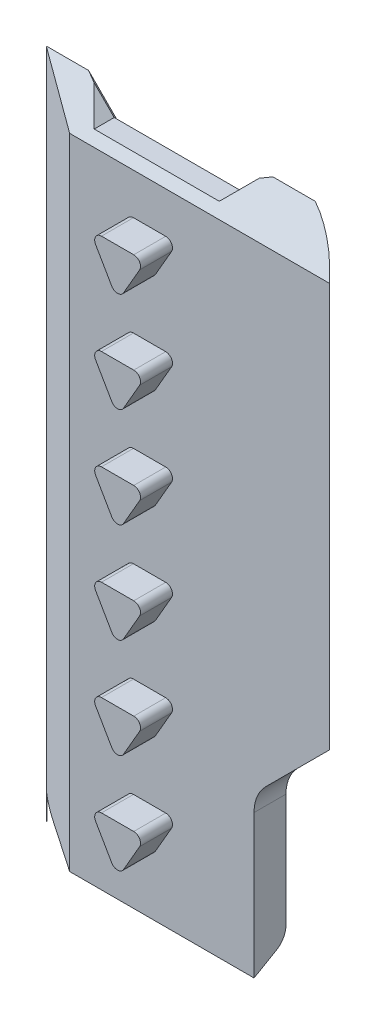
from build123d import *

# Parameters (mm, degrees)
SKETCH_1_W          = 100
SKETCH_1_H          = 168
EXTRUDE_1_DEPTH     = 8
SKETCH_4_W          = 219.714234424
SKETCH_4_H          = 60.92406831
CUT_EXTRUDE_2_DEPTH = 8
SKETCH_5_W          = 131.187185814
SKETCH_5_H          = 64.749040209
CUT_EXTRUDE_3_DEPTH = 28
CUT_EXTRUDE_4_DEPTH = 198
SKETCH_7_W          = 88.901088493
SKETCH_7_H          = 24.075683618
CUT_EXTRUDE_5_DEPTH = 198
FILLET_2_R          = 5
CUT_EXTRUDE_6_DEPTH = 20
FILLET_3_R          = 10
EXTRUDE_2_DEPTH     = 8
CUT_EXTRUDE_7_DEPTH = 10
CHAMFER_1_SIZE      = 1


with BuildPart() as part:
    # 草图1 → 凸台-拉伸1 (new body)
    with BuildSketch(Plane.XY):
        Rectangle(SKETCH_1_W, SKETCH_1_H)
    extrude(amount=EXTRUDE_1_DEPTH)

    # 草图4 → 切除-拉伸2 (cut)
    with BuildSketch(Plane(origin=(-12.5, 0, 21.650635095), x_dir=(0, -1, 0), z_dir=(-0.499999999999998, 0, 0.8660254037844398))):
        with Locations((1.453456898, -25.633998951)):
            Rectangle(SKETCH_4_W, SKETCH_4_H)
    extrude(amount=CUT_EXTRUDE_2_DEPTH, mode=Mode.SUBTRACT)

    # 草图5 → 切除-拉伸3 (cut)
    with BuildSketch(Plane(origin=(0, 42, 42), x_dir=(-1, 0, 0), z_dir=(0, 0.7071067811865464, 0.7071067811865488))):
        with Locations((-5.06731619, -49.688146971)):
            Rectangle(SKETCH_5_W, SKETCH_5_H)
    extrude(amount=CUT_EXTRUDE_3_DEPTH, mode=Mode.SUBTRACT)

    # 草图6 → 切除-拉伸4 (cut)
    with BuildSketch(Plane.XZ.offset(84)):
        with BuildLine():
            Line((17.306736075, 0), (50, 0))
            Line((50, 0), (50, 8))
            Line((50, 8), (28.897086236, 8))
            ThreePointArc((28.897086236, 8), (23.578001039, 3.310243942), (17.306736075, 0))
        make_face()
    extrude(amount=-CUT_EXTRUDE_4_DEPTH, mode=Mode.SUBTRACT)

    # 草图7 → 切除-拉伸5 (cut)
    with BuildSketch(Plane(origin=(0, -59.535898385, -34.373066959), x_dir=(1, 0, 0), z_dir=(0, -0.866025403784438, -0.500000000000001))):
        with Locations((-5.418701979, 40.753668269)):
            Rectangle(SKETCH_7_W, SKETCH_7_H)
    extrude(amount=CUT_EXTRUDE_5_DEPTH, mode=Mode.SUBTRACT)

    # 圆角2
    # the kernel refuses this fillet: 5 mm, written as the material it takes off along each edge
    with BuildSketch(Plane(origin=(24.52361444, -79.381197846, 0), x_dir=(0, 1, 0), z_dir=(-1, 0, 0))) as fillet_2_piece_1:
        with BuildLine():
            CenterArc((FILLET_2_R * 0.57735026919, -FILLET_2_R), FILLET_2_R, 90, 60)
            Line((-FILLET_2_R * 0.288675134595, -FILLET_2_R * 0.5), (0, 0))
            Line((0, 0), (FILLET_2_R * 0.57735026919, 0))
        make_face()
    extrude(amount=74.392860666, mode=Mode.SUBTRACT)

    # 草图8 → 切除-拉伸6 (cut)
    with BuildSketch(Plane(origin=(0, 0, 0), x_dir=(-1, 0, 0), z_dir=(0, 0, -1))):
        Polygon((-60, 6), (-10, -44), (-10, -84), (0, -94), (-20, -94), (-60, -94), align=None)
    extrude(amount=-CUT_EXTRUDE_6_DEPTH, mode=Mode.SUBTRACT)

    # 圆角3
    fillet_3_edges = [part.edges().sort_by_distance(p)[0] for p in [
        (10, -44, 4),
    ]]
    fillet(fillet_3_edges, radius=FILLET_3_R)

    # 草图9 → 凸台-拉伸2 (add)
    with BuildSketch(Plane.XY.offset(8)):
        with BuildLine():
            ThreePointArc((-17.615836726, 56.159618943), (-16.143593539, 55.309618943), (-14.671350353, 56.159618943))
            Line((-14.671350353, 56.159618943), (-10.635451968, 63.15))
            ThreePointArc((-10.635451968, 63.15), (-10.635451968, 64.85), (-12.107695155, 65.7))
            Line((-12.107695155, 65.7), (-20.179491924, 65.7))
            ThreePointArc((-20.179491924, 65.7), (-21.651735111, 64.85), (-21.651735111, 63.15))
            Line((-21.651735111, 63.15), (-17.615836726, 56.159618943))
        make_face()
        with BuildLine():
            ThreePointArc((-17.615836726, 31.159618943), (-16.143593539, 30.309618943), (-14.671350353, 31.159618943))
            Line((-14.671350353, 31.159618943), (-10.635451968, 38.15))
            ThreePointArc((-10.635451968, 38.15), (-10.635451968, 39.85), (-12.107695155, 40.7))
            Line((-12.107695155, 40.7), (-20.179491924, 40.7))
            ThreePointArc((-20.179491924, 40.7), (-21.651735111, 39.85), (-21.651735111, 38.15))
            Line((-21.651735111, 38.15), (-17.615836726, 31.159618943))
        make_face()
        with BuildLine():
            ThreePointArc((-17.615836726, 6.159618943), (-16.143593539, 5.309618943), (-14.671350353, 6.159618943))
            Line((-14.671350353, 6.159618943), (-10.635451968, 13.15))
            ThreePointArc((-10.635451968, 13.15), (-10.635451968, 14.85), (-12.107695155, 15.7))
            Line((-12.107695155, 15.7), (-20.179491924, 15.7))
            ThreePointArc((-20.179491924, 15.7), (-21.651735111, 14.85), (-21.651735111, 13.15))
            Line((-21.651735111, 13.15), (-17.615836726, 6.159618943))
        make_face()
        with BuildLine():
            ThreePointArc((-17.615836726, -18.840381057), (-16.143593539, -19.690381057), (-14.671350353, -18.840381057))
            Line((-14.671350353, -18.840381057), (-10.635451968, -11.85))
            ThreePointArc((-10.635451968, -11.85), (-10.635451968, -10.15), (-12.107695155, -9.3))
            Line((-12.107695155, -9.3), (-20.179491924, -9.3))
            ThreePointArc((-20.179491924, -9.3), (-21.651735111, -10.15), (-21.651735111, -11.85))
            Line((-21.651735111, -11.85), (-17.615836726, -18.840381057))
        make_face()
        with BuildLine():
            ThreePointArc((-17.615836726, -43.840381057), (-16.143593539, -44.690381057), (-14.671350353, -43.840381057))
            Line((-14.671350353, -43.840381057), (-10.635451968, -36.85))
            ThreePointArc((-10.635451968, -36.85), (-10.635451968, -35.15), (-12.107695155, -34.3))
            Line((-12.107695155, -34.3), (-20.179491924, -34.3))
            ThreePointArc((-20.179491924, -34.3), (-21.651735111, -35.15), (-21.651735111, -36.85))
            Line((-21.651735111, -36.85), (-17.615836726, -43.840381057))
        make_face()
        with BuildLine():
            ThreePointArc((-10.635451968, -61.85), (-10.635451968, -60.15), (-12.107695155, -59.3))
            Line((-12.107695155, -59.3), (-20.179491924, -59.3))
            ThreePointArc((-20.179491924, -59.3), (-21.651735111, -60.15), (-21.651735111, -61.85))
            Line((-21.651735111, -61.85), (-17.615836726, -68.840381057))
            ThreePointArc((-17.615836726, -68.840381057), (-16.143593539, -69.690381057), (-14.671350353, -68.840381057))
            Line((-14.671350353, -68.840381057), (-10.635451968, -61.85))
        make_face()
    extrude(amount=EXTRUDE_2_DEPTH)

    # 草图10 → 切除-拉伸7 (cut)
    with BuildSketch(Plane(origin=(0, 0, 0), x_dir=(-1, 0, 0), z_dir=(0, 0, -1))):
        Polygon((-5.306736075, 84), (0.693263925, 78), (32, 78), (38, 84), align=None)
    extrude(amount=-CUT_EXTRUDE_7_DEPTH, mode=Mode.SUBTRACT)

    # 倒角1
    chamfer_1_edges = [part.edges().sort_by_distance(p)[0] for p in [
        (2.306736075, 81, 0),
        (-16.346631963, 78, 0),
        (-35, 81, 0),
    ]]
    chamfer(chamfer_1_edges, length=CHAMFER_1_SIZE)


solid = part.part
